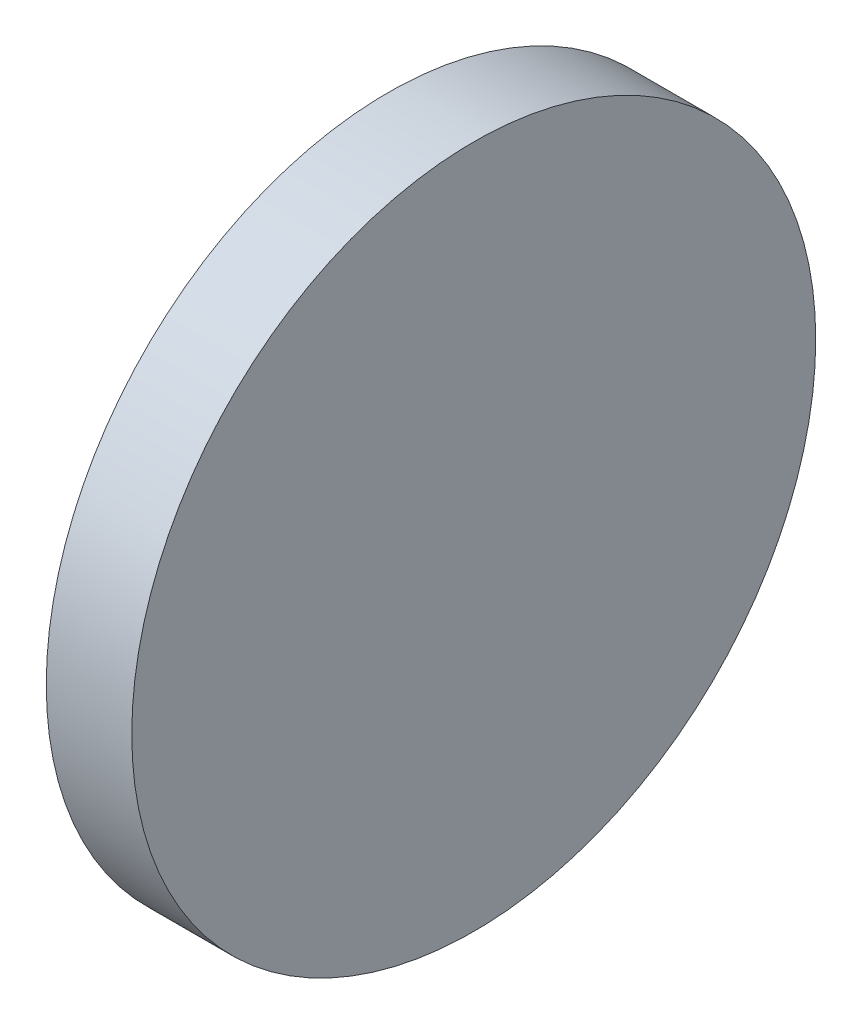
from build123d import *

# Parameters (mm, degrees)
ESQUISSE1_R        = 40
ESQUISSE1_R_2      = 5.5
BOSS_EXTRU_1_DEPTH = 10
BOSS_EXTRU_2_START = -8
ESQUISSE2_R        = 40
BOSS_EXTRU_2_DEPTH = 8


with BuildPart() as part:
    # Esquisse1 → Boss.-Extru.1 (new body)
    with BuildSketch(Plane.YZ):
        Circle(ESQUISSE1_R)
        with Locations((0, 32)):
            Circle(ESQUISSE1_R_2, mode=Mode.SUBTRACT)
        with Locations((12.245869836, 29.56414504)):
            Circle(ESQUISSE1_R_2, mode=Mode.SUBTRACT)
        with Locations((22.627416998, 22.627416998)):
            Circle(ESQUISSE1_R_2, mode=Mode.SUBTRACT)
        with Locations((29.56414504, 12.245869836)):
            Circle(ESQUISSE1_R_2, mode=Mode.SUBTRACT)
        with Locations((32, 0)):
            Circle(ESQUISSE1_R_2, mode=Mode.SUBTRACT)
        with Locations((29.56414504, -12.245869836)):
            Circle(ESQUISSE1_R_2, mode=Mode.SUBTRACT)
        with Locations((22.627416998, -22.627416998)):
            Circle(ESQUISSE1_R_2, mode=Mode.SUBTRACT)
        with Locations((12.245869836, -29.56414504)):
            Circle(ESQUISSE1_R_2, mode=Mode.SUBTRACT)
        with Locations((0, -32)):
            Circle(ESQUISSE1_R_2, mode=Mode.SUBTRACT)
        with Locations((-12.245869836, -29.56414504)):
            Circle(ESQUISSE1_R_2, mode=Mode.SUBTRACT)
        with Locations((-22.627416998, -22.627416998)):
            Circle(ESQUISSE1_R_2, mode=Mode.SUBTRACT)
        with Locations((-29.56414504, -12.245869836)):
            Circle(ESQUISSE1_R_2, mode=Mode.SUBTRACT)
        with Locations((-32, 0)):
            Circle(ESQUISSE1_R_2, mode=Mode.SUBTRACT)
        with Locations((-29.56414504, 12.245869836)):
            Circle(ESQUISSE1_R_2, mode=Mode.SUBTRACT)
        with Locations((-22.627416998, 22.627416998)):
            Circle(ESQUISSE1_R_2, mode=Mode.SUBTRACT)
        with Locations((-12.245869836, 29.56414504)):
            Circle(ESQUISSE1_R_2, mode=Mode.SUBTRACT)
        with Locations((-11.429260712, 17.105097445)):
            Circle(ESQUISSE1_R_2, mode=Mode.SUBTRACT)
        with Locations((4.013422643, 20.17683815)):
            Circle(ESQUISSE1_R_2, mode=Mode.SUBTRACT)
        with Locations((17.105097445, 11.429260712)):
            Circle(ESQUISSE1_R_2, mode=Mode.SUBTRACT)
        with Locations((20.17683815, -4.013422643)):
            Circle(ESQUISSE1_R_2, mode=Mode.SUBTRACT)
        with Locations((11.429260712, -17.105097445)):
            Circle(ESQUISSE1_R_2, mode=Mode.SUBTRACT)
        with Locations((-4.013422643, -20.17683815)):
            Circle(ESQUISSE1_R_2, mode=Mode.SUBTRACT)
        with Locations((-17.105097445, -11.429260712)):
            Circle(ESQUISSE1_R_2, mode=Mode.SUBTRACT)
        with Locations((-20.17683815, 4.013422643)):
            Circle(ESQUISSE1_R_2, mode=Mode.SUBTRACT)
        with Locations((5.527683242, 8.272762594)):
            Circle(ESQUISSE1_R_2, mode=Mode.SUBTRACT)
        with Locations((8.272762594, -5.527683242)):
            Circle(ESQUISSE1_R_2, mode=Mode.SUBTRACT)
        with Locations((-5.527683242, -8.272762594)):
            Circle(ESQUISSE1_R_2, mode=Mode.SUBTRACT)
        with Locations((-8.272762594, 5.527683242)):
            Circle(ESQUISSE1_R_2, mode=Mode.SUBTRACT)
    extrude(amount=BOSS_EXTRU_1_DEPTH)

    # Esquisse2 → Boss.-Extru.2 (add)
    with BuildSketch(Plane.YZ.offset(10).offset(BOSS_EXTRU_2_START)):
        Circle(ESQUISSE2_R)
    extrude(amount=BOSS_EXTRU_2_DEPTH)


solid = part.part
